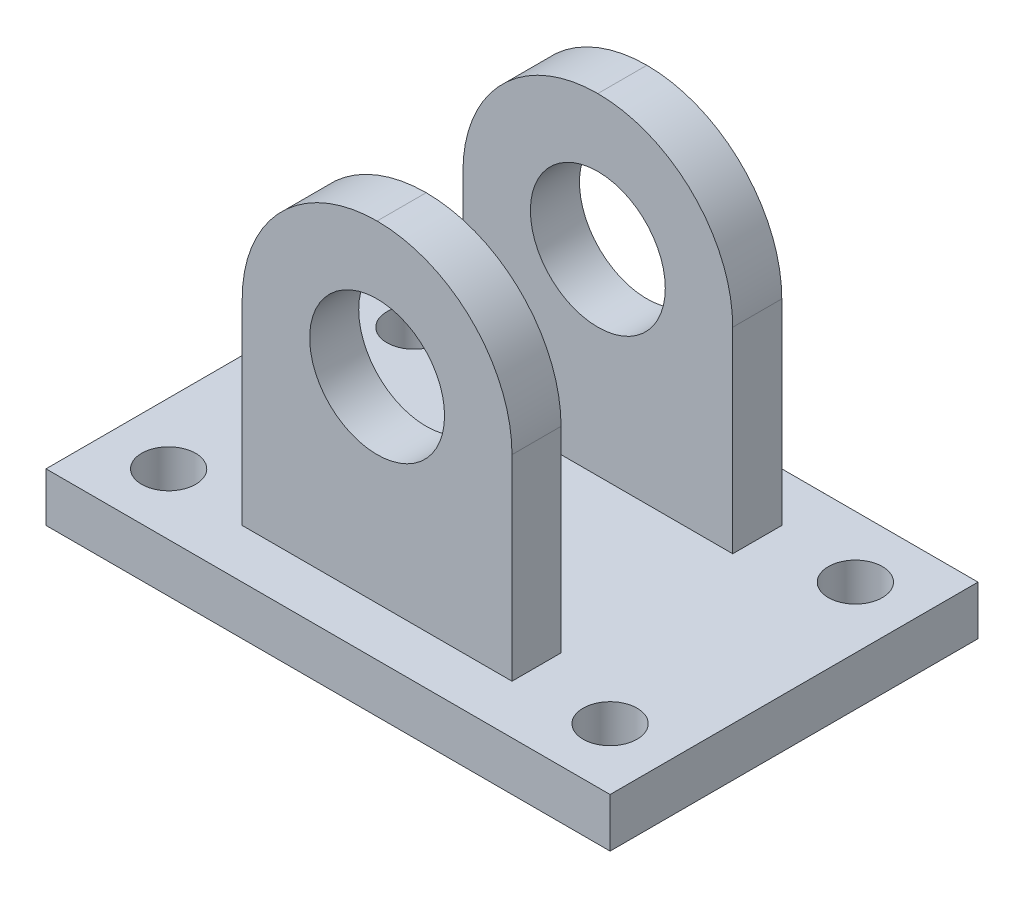
from build123d import *

# Parameters (mm, degrees)
SKETCH_1_W                  = 230
SKETCH_1_H                  = 150
EXTRUDE_1_DEPTH             = 20
SKETCH_2_W                  = 110
SKETCH_2_H                  = 20
EXTRUDE_2_DEPTH             = 135
FILLET_1_R                  = 55
SKETCH_4_R                  = 27.5
CUT_EXTRUDE_1_DEPTH         = 233.701525564
SKETCH_5_R                  = 11
CUT_EXTRUDE_2_DEPTH         = 193.54869514
PATTERN_LINEAR_1_COUNT      = 2
PATTERN_LINEAR_1_PITCH      = 180
PATTERN_LINEAR_1_COUNT_DIR2 = 2
PATTERN_LINEAR_1_PITCH_DIR2 = 100


with BuildPart() as part:
    # 草图1 → 凸台-拉伸1 (new body)
    with BuildSketch(Plane(origin=(0, 0, 0), x_dir=(1, 0, 0), z_dir=(0, 1, 0))):
        Rectangle(SKETCH_1_W, SKETCH_1_H)
    extrude(amount=EXTRUDE_1_DEPTH)

    # 草图2 → 凸台-拉伸2 (add)
    with BuildSketch(Plane(origin=(0, 20, 0), x_dir=(1, 0, 0), z_dir=(0, 1, 0))):
        with Locations((0, 45)):
            Rectangle(SKETCH_2_W, SKETCH_2_H)
    extrude_2 = extrude(amount=EXTRUDE_2_DEPTH)

    # 镜向1: 凸台-拉伸2 across plane
    add(extrude_2.mirror(Plane.XY))

    # 圆角1
    fillet_1_edges = [part.edges().sort_by_distance(p)[0] for p in [
        (-55, 155, -45),
        (55, 155, -45),
        (-55, 155, 45),
        (55, 155, 45),
    ]]
    fillet(fillet_1_edges, radius=FILLET_1_R - 0.0001)  # a hair under: the kernel refuses the full size

    # 草图4 → 切除-拉伸1 (cut, through all)
    with BuildSketch(Plane.XY.offset(55)):
        with Locations((0, 100)):
            Circle(SKETCH_4_R)
    extrude(amount=-CUT_EXTRUDE_1_DEPTH, mode=Mode.SUBTRACT)

    # 草图5 → 切除-拉伸2 (cut, through all)
    with BuildSketch(Plane(origin=(0, 20, 0), x_dir=(1, 0, 0), z_dir=(0, 1, 0))):
        with Locations(Location((-90, 50, 0), (0, 0, 270))):
            Circle(SKETCH_5_R)
    cut_extrude_2 = extrude(amount=-CUT_EXTRUDE_2_DEPTH, mode=Mode.SUBTRACT)

    # 阵列(线性)1: Cut-Extrude 2 2 × 2
    with Locations(*[(i * PATTERN_LINEAR_1_PITCH, 0, j * PATTERN_LINEAR_1_PITCH_DIR2) for i in range(PATTERN_LINEAR_1_COUNT) for j in range(PATTERN_LINEAR_1_COUNT_DIR2) if (i, j) != (0, 0)]):
        add(cut_extrude_2, mode=Mode.SUBTRACT)


solid = part.part
